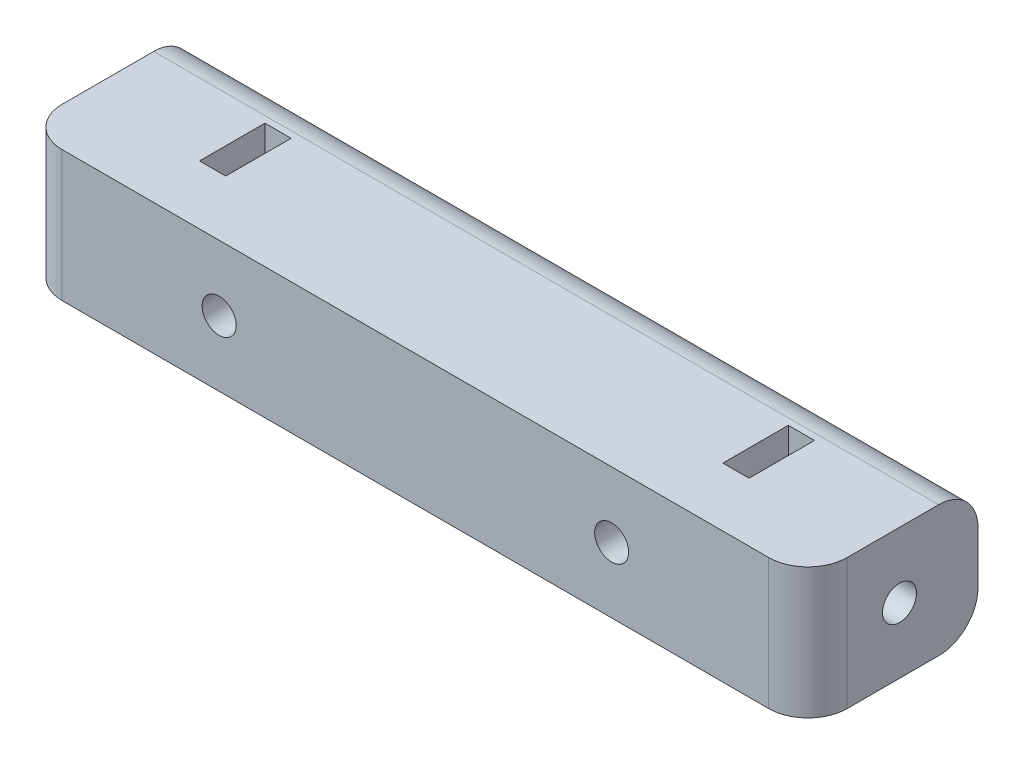
from build123d import *

# Parameters (mm, degrees)
SKETCH2_W           = 60
SKETCH2_H           = 10
BOSS_EXTRUDE1_DEPTH = 13
CUT_EXTRUDE1_DEPTH  = 3
SKETCH4_R           = 1.3
CUT_EXTRUDE2_DEPTH  = 33.015621187
FILLET1_R           = 3
FILLET2_R           = 3
SKETCH5_R           = 1.3
CUT_EXTRUDE3_DEPTH  = 10
SKETCH6_W           = 2
SKETCH6_H           = 5
CUT_EXTRUDE4_DEPTH  = 35.190641995


with BuildPart() as part:
    # Sketch2 → Boss-Extrude1 (new body)
    with BuildSketch(Plane.XY):
        Rectangle(SKETCH2_W, SKETCH2_H)
    extrude(amount=BOSS_EXTRUDE1_DEPTH)

    # Sketch3 → Cut-Extrude1 (cut)
    with BuildSketch(Plane(origin=(0, 0, 0), x_dir=(-1, 0, 0), z_dir=(0, 0, -1))):
        Polygon((-15, -3), (-12.401923789, -1.5), (-12.401923789, 1.5), (-15, 3), (-17.598076211, 1.5), (-17.598076211, -1.5), align=None)
        Polygon((15, -3), (17.598076211, -1.5), (17.598076211, 1.5), (15, 3), (12.401923789, 1.5), (12.401923789, -1.5), align=None)
    extrude(amount=-CUT_EXTRUDE1_DEPTH, mode=Mode.SUBTRACT)

    # Sketch4 → Cut-Extrude2 (cut, through all)
    with BuildSketch(Plane(origin=(0, 0, 3), x_dir=(-1, 0, 0), z_dir=(0, 0, -1))):
        with Locations((-15, 0)):
            Circle(SKETCH4_R)
        with Locations((15, 0)):
            Circle(SKETCH4_R)
    extrude(amount=-CUT_EXTRUDE2_DEPTH, mode=Mode.SUBTRACT)

    # Fillet1
    # the kernel refuses this fillet: 3 mm, written as the material it takes off along each edge
    with BuildSketch(Plane(origin=(37.5, -5, 0), x_dir=(0, 1, 0), z_dir=(-1, 0, 0))) as fillet1_piece_1:
        with BuildLine():
            CenterArc((FILLET1_R, -FILLET1_R), FILLET1_R, 90, 90)
            Line((0, -FILLET1_R), (0, 0))
            Line((0, 0), (FILLET1_R, 0))
        make_face()
    extrude(amount=75, mode=Mode.SUBTRACT)
    with BuildSketch(Plane(origin=(-37.5, 5, 0), x_dir=(0, 0, 1), z_dir=(1, 0, 0))) as fillet1_piece_2:
        with BuildLine():
            CenterArc((FILLET1_R, FILLET1_R), FILLET1_R, 180, 90)
            Line((0, FILLET1_R), (0, 0))
            Line((0, 0), (FILLET1_R, 0))
        make_face()
    extrude(amount=75, mode=Mode.SUBTRACT)

    # Fillet2
    fillet2_edges = [part.edges().sort_by_distance(p)[0] for p in [
        (-30, 0, 13),
        (30, 0, 13),
    ]]
    fillet(fillet2_edges, radius=FILLET2_R)

    # Sketch5 → Cut-Extrude3 (cut)
    with BuildSketch(Plane(origin=(30, 0, 0), x_dir=(0, 0, -1), z_dir=(1, 0, 0))):
        with Locations(Location((-6, 0, 0), (0, 0, 90))):
            Circle(SKETCH5_R)
    cut_extrude3 = extrude(amount=-CUT_EXTRUDE3_DEPTH, mode=Mode.SUBTRACT)

    # Sketch6 → Cut-Extrude4 (cut, symmetric)
    with BuildSketch(Plane(origin=(0, 5, 0), x_dir=(1, 0, 0), z_dir=(0, 1, 0))):
        with Locations((20, -6)):
            Rectangle(SKETCH6_W, SKETCH6_H)
    cut_extrude4 = extrude(amount=CUT_EXTRUDE4_DEPTH, both=True, mode=Mode.SUBTRACT)

    # Mirror1: Cut-Extrude3, Cut-Extrude4 across plane
    add(cut_extrude3.mirror(Plane(origin=(0, 0, 0), x_dir=(0, 0, 1), z_dir=(1, 0, 0))), mode=Mode.SUBTRACT)
    add(cut_extrude4.mirror(Plane(origin=(0, 0, 0), x_dir=(0, 0, 1), z_dir=(1, 0, 0))), mode=Mode.SUBTRACT)


solid = part.part
